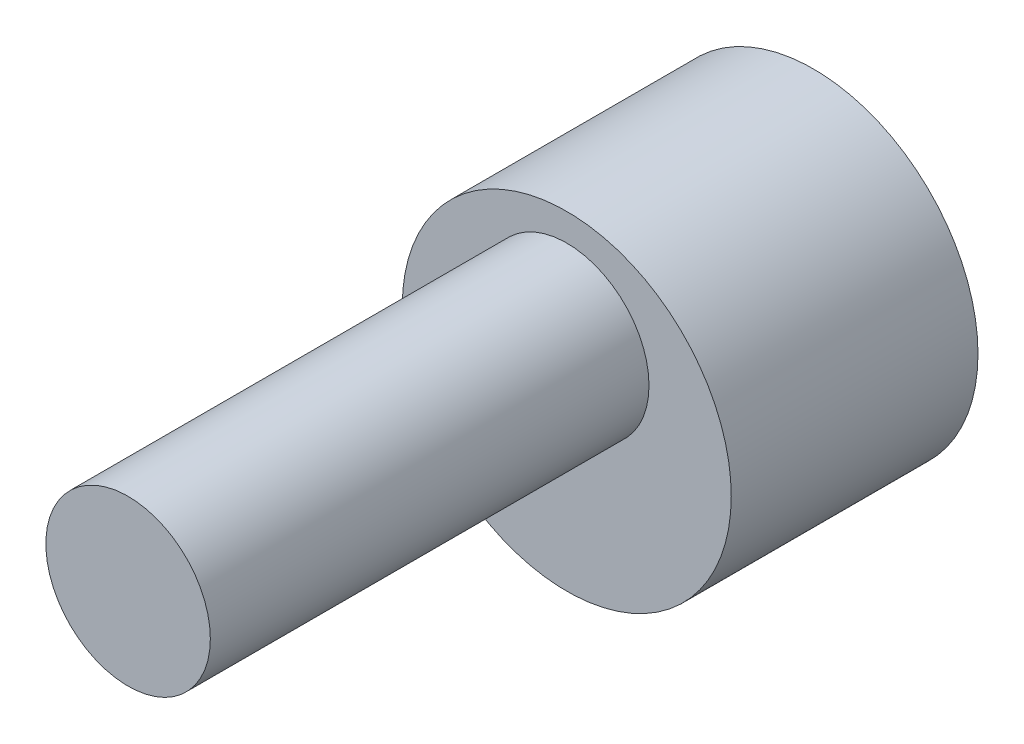
from build123d import *

# Parameters (mm, degrees)
ESQUISSE1_R        = 6
BOSS_EXTRU_1_DEPTH = 9
ESQUISSE2_R        = 3
BOSS_EXTRU_2_DEPTH = 16


with BuildPart() as part:
    # Esquisse1 → Boss.-Extru.1 (new body)
    with BuildSketch(Plane.XY):
        Circle(ESQUISSE1_R)
    extrude(amount=BOSS_EXTRU_1_DEPTH)

    # Esquisse2 → Boss.-Extru.2 (add)
    with BuildSketch(Plane.XY.offset(9)):
        with Locations((0, 2)):
            Circle(ESQUISSE2_R)
    extrude(amount=BOSS_EXTRU_2_DEPTH)


solid = part.part
